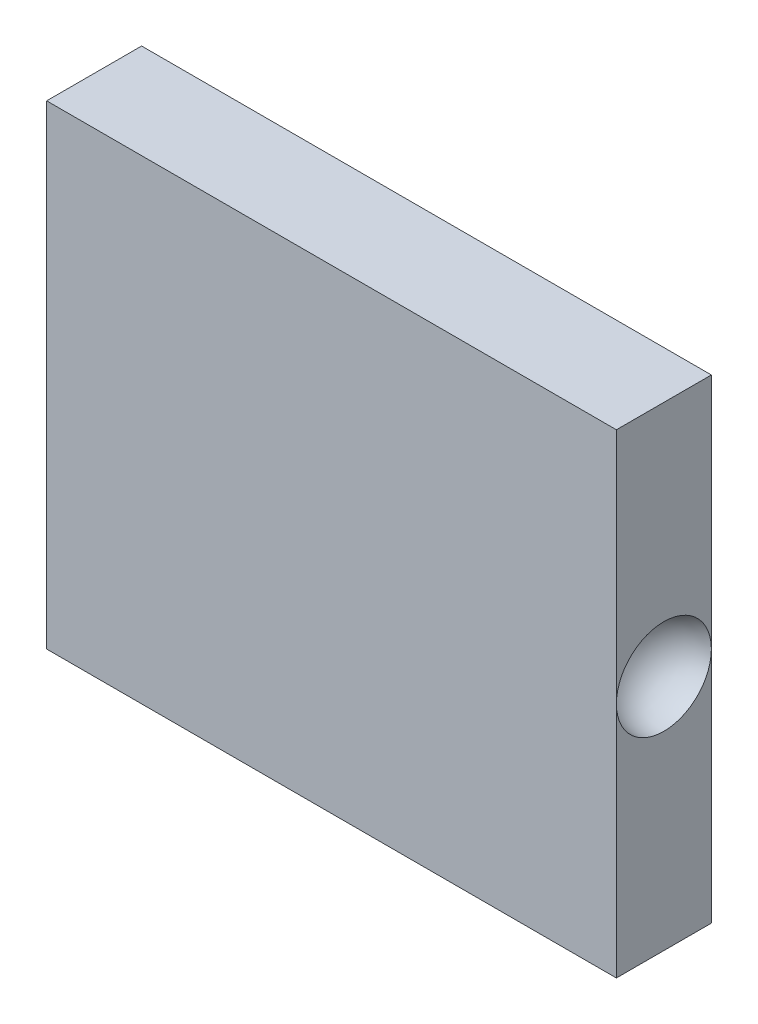
from build123d import *
from build123d.topology import SkipClean

# Parameters (mm, degrees)
SKETCH_2_W      = 60
SKETCH_2_H      = 50
EXTRUDE_1_DEPTH = 10


with BuildPart() as part:
    # 草图2 → 凸台-拉伸1 (new body)
    with BuildSketch(Plane.XY):
        Rectangle(SKETCH_2_W, SKETCH_2_H)
    extrude(amount=EXTRUDE_1_DEPTH)

    # 草图5 → 切除-旋转5 (revolve, cut)
    with BuildSketch(Plane(origin=(0, 0, 0), x_dir=(1, 0, 0), z_dir=(0, 1, 0))):
        with BuildLine():
            Line((-30, 0), (-30, -10))
            ThreePointArc((-30, -10), (-25, -5), (-30, 0))
        make_face()
    cut_revolve_5 = revolve(axis=Axis((-30, 0, 0), (0, 0, 1)), mode=Mode.SUBTRACT)

    # 镜向1: 切除-旋转5 across plane
    with SkipClean():  # the faces are left unmerged after this step: merging them gives an invalid solid
        add(cut_revolve_5.mirror(Plane(origin=(0, 0, 0), x_dir=(0, 0, 1), z_dir=(1, 0, 0))), mode=Mode.SUBTRACT)

    # 草图6 → 切除-旋转6 (revolve, cut)
    with SkipClean():  # the faces are left unmerged after this step: merging them gives an invalid solid
        with BuildSketch(Plane(origin=(0, 0, 0), x_dir=(1, 0, 0), z_dir=(0, 1, 0))):
            with BuildLine():
                Line((-9.2, 0), (9.2, 0))
                ThreePointArc((9.2, 0), (0, -9.2), (-9.2, 0))
            make_face()
        revolve(axis=Axis((-9.2, 0, 0), (1, 0, 0)), mode=Mode.SUBTRACT)


solid = part.part
